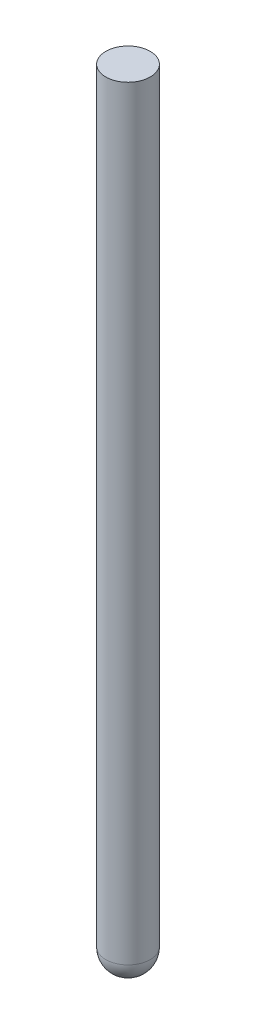
from build123d import *

# Parameters (mm, degrees)
SKETCH1_R           = 5.026321837
BOSS_EXTRUDE1_DEPTH = 177.8
FILLET1_R           = 4.953


with BuildPart() as part:
    # Sketch1 → Boss-Extrude1 (new body)
    with BuildSketch(Plane(origin=(0, 0, 0), x_dir=(1, 0, 0), z_dir=(0, 1, 0))):
        Circle(SKETCH1_R)
    extrude(amount=BOSS_EXTRUDE1_DEPTH)

    # Fillet1
    fillet1_edges = [part.edges().sort_by_distance(p)[0] for p in [
        (-5.026321837, 0, 0),
    ]]
    fillet(fillet1_edges, radius=FILLET1_R)


solid = part.part
